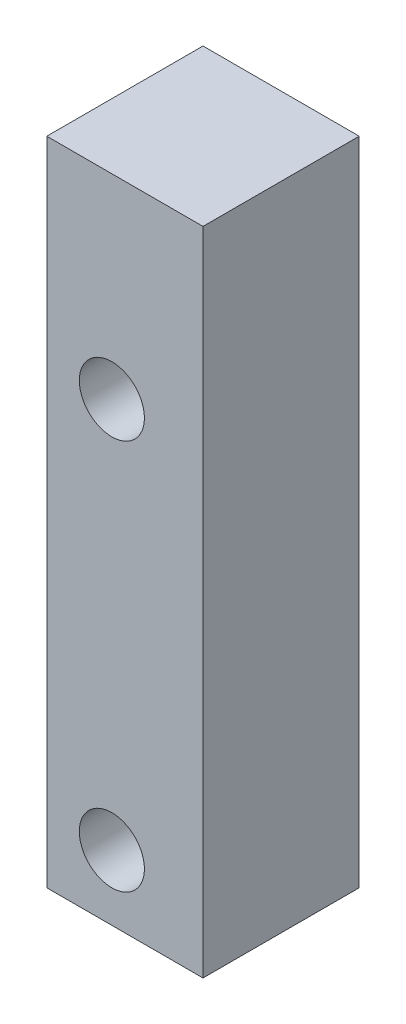
from build123d import *

# Parameters (mm, degrees)
ESQUISSE1_W                  = 12
ESQUISSE1_H                  = 50
BOSS_EXTRU_1_DEPTH           = 12
ENL_V_MAT_EXTRU_1_DEPTH      = 53.80151513
ENL_V_MAT_EXTRU_1_DEPTH_BACK = 53.80151513
ESQUISSE3_R                  = 2.5


with BuildPart() as part:
    # Esquisse1 → Boss.-Extru.1 (new body)
    with BuildSketch(Plane.XY):
        with Locations((6, 25)):
            Rectangle(ESQUISSE1_W, ESQUISSE1_H)
    extrude(amount=BOSS_EXTRU_1_DEPTH)

    # Esquisse3 → Enlèv. mat.-Extru.1 (cut, two sides: drawn at the far end of the back side and taken through both)
    with BuildSketch(Plane.XY.offset(12).offset(-ENL_V_MAT_EXTRU_1_DEPTH_BACK)):
        with Locations((5, 5)):
            Circle(ESQUISSE3_R)
        with Locations((5, 35)):
            Circle(ESQUISSE3_R)
    extrude(amount=ENL_V_MAT_EXTRU_1_DEPTH + ENL_V_MAT_EXTRU_1_DEPTH_BACK, mode=Mode.SUBTRACT)


solid = part.part
